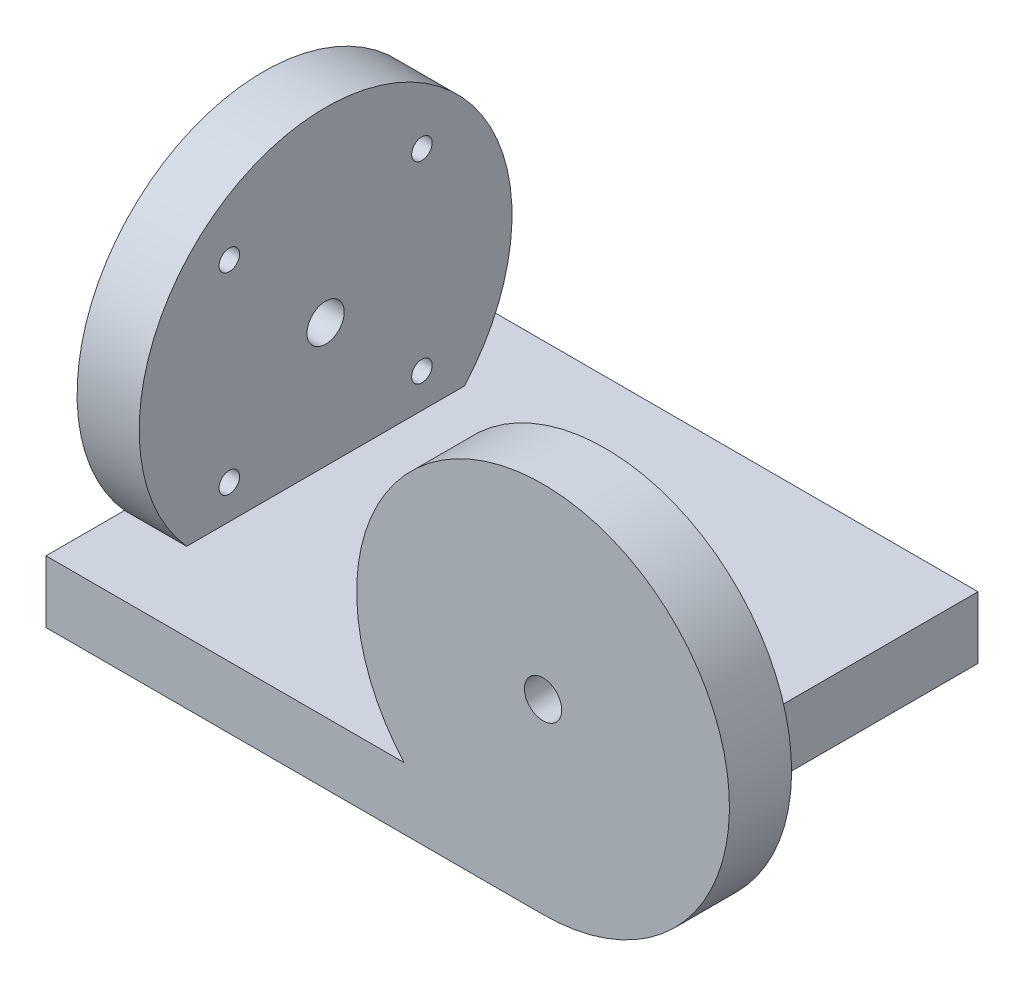
from build123d import *

# Parameters (mm, degrees)
SKETCH1_R                 = 30
BOSS_EXTRUDE1_DEPTH       = 10
SKETCH2_W                 = 80
SKETCH2_H                 = 10
BOSS_EXTRUDE2_DEPTH       = 70
SKETCH3_R                 = 30
BOSS_EXTRUDE3_DEPTH       = 10
F_6_0MM_DOWEL_HOLE2_D     = 6
M4X0_7_TAPPED_HOLE1_D     = 3.3
M4X0_7_TAPPED_HOLE1_DEPTH = 6
M4X0_7_TAPPED_HOLE1_TIP   = 0.991420021
F_6_0MM_DOWEL_HOLE3_D     = 6
M4X0_7_TAPPED_HOLE2_D     = 3.3
M4X0_7_TAPPED_HOLE2_DEPTH = 6
M4X0_7_TAPPED_HOLE2_TIP   = 0.991420021


with BuildPart() as part:
    # Sketch1 → Boss-Extrude1 (new body)
    with BuildSketch(Plane.XY):
        Circle(SKETCH1_R)
    extrude(amount=BOSS_EXTRUDE1_DEPTH)

    # Sketch2 → Boss-Extrude2 (add)
    with BuildSketch(Plane.XY.offset(10)):
        with Locations((-40, -25)):
            Rectangle(SKETCH2_W, SKETCH2_H)
    extrude(amount=-BOSS_EXTRUDE2_DEPTH)

    # Sketch3 → Boss-Extrude3 (add)
    with BuildSketch(Plane.ZY.offset(80)):
        with Locations((-25, 0)):
            Circle(SKETCH3_R)
    extrude(amount=-BOSS_EXTRUDE3_DEPTH)

    # Ø6.0mm Dowel Hole2 (through all)
    with Locations(Plane(origin=(0, 0, 0), x_dir=(-1, 0, 0), z_dir=(0, 0, -1))):
        with Locations((0, 0)):
            Hole(F_6_0MM_DOWEL_HOLE2_D / 2)

    # M4x0.7 Tapped Hole1
    with Locations(Plane(origin=(0, 0, 0), x_dir=(-1, 0, 0), z_dir=(0, 0, -1))):
        with Locations((-15.5, 15.5), (15.5, 15.5), (15.5, -15.5), (-15.5, -15.5)):
            Hole(M4X0_7_TAPPED_HOLE1_D / 2, depth=M4X0_7_TAPPED_HOLE1_DEPTH)
            with Locations((0, 0, -(M4X0_7_TAPPED_HOLE1_DEPTH + M4X0_7_TAPPED_HOLE1_TIP / 2))):  # 118° drill point
                Cone(0, M4X0_7_TAPPED_HOLE1_D / 2, M4X0_7_TAPPED_HOLE1_TIP, mode=Mode.SUBTRACT)

    # Ø6.0mm Dowel Hole3 (through all)
    with Locations(Plane(origin=(-70, 1.006067482, -20.993447812), x_dir=(0, 0, -1), z_dir=(1, 0, 0))):
        with Locations((4.006552188, -1.006067482)):
            Hole(F_6_0MM_DOWEL_HOLE3_D / 2)

    # M4x0.7 Tapped Hole2
    with Locations(Plane(origin=(-70, 1.006067482, -20.993447812), x_dir=(0, 0, -1), z_dir=(1, 0, 0))):
        with Locations((-11.493447812, 15.5), (19.506552188, 15.5), (19.506552188, -15.5), (-11.493447812, -15.5)):
            Hole(M4X0_7_TAPPED_HOLE2_D / 2, depth=M4X0_7_TAPPED_HOLE2_DEPTH)
            with Locations((0, 0, -(M4X0_7_TAPPED_HOLE2_DEPTH + M4X0_7_TAPPED_HOLE2_TIP / 2))):  # 118° drill point
                Cone(0, M4X0_7_TAPPED_HOLE2_D / 2, M4X0_7_TAPPED_HOLE2_TIP, mode=Mode.SUBTRACT)


solid = part.part
